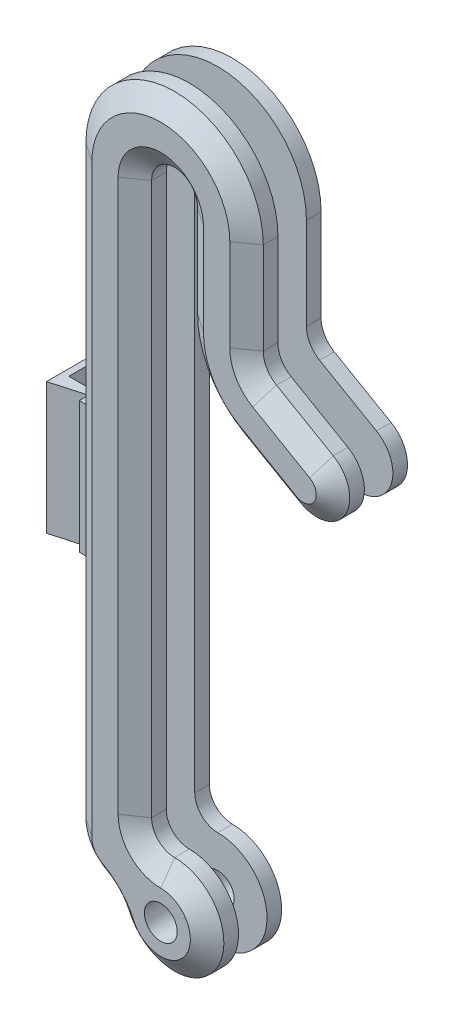
from build123d import *
from OCP.BRepFilletAPI import BRepFilletAPI_MakeChamfer

# Parameters (mm, degrees)
SKETCH1_R           = 3.175
BOSS_EXTRUDE1_DEPTH = 16.51
FILLET1_R           = 10.16
CHAMFER1_SIZE       = 3.81
CHAMFER1_SIZE2      = 2.667790721
SPLIT1_START        = 5.503333164
SPLIT1_OUTLINE_R    = 3.175
SPLIT1_DEPTH        = 5.503333418
SKETCH4_W           = 11.174418558
SKETCH4_H           = 25.4
BOSS_EXTRUDE2_DEPTH = 12.7
SKETCH5_W           = 5.08
SKETCH5_H           = 11.174418558
CUT_EXTRUDE1_DEPTH  = 95.217988066
SKETCH7_W           = 5.08
SKETCH7_H           = 5.08
CUT_EXTRUDE2_DEPTH  = 20.32


# Read off the part's stored shape, not the designer's step: Split1
with BuildPart() as part:
    # Sketch1 → Boss-Extrude1 (new body)
    with BuildSketch(Plane.XY):
        with BuildLine():
            Line((4.445, 120.65), (4.445, 102.87))
            ThreePointArc((4.445, 102.87), (6.827068321, 93.98), (13.335, 87.472068321))
            Line((13.335, 87.472068321), (24.333522628, 81.122068321))
            ThreePointArc((24.333522628, 81.122068321), (33.007783942, 83.446329635), (30.683522628, 92.120590949))
            Line((30.683522628, 92.120590949), (19.685, 98.470590949))
            ThreePointArc((19.685, 98.470590949), (17.825590949, 100.33), (17.145, 102.87))
            Line((17.145, 102.87), (17.145, 120.65))
            ThreePointArc((17.145, 120.65), (0, 137.795), (-17.145, 120.65))
            Line((-17.145, 120.65), (-17.145, 7.62))
            ThreePointArc((-17.145, 7.62), (-14.913153673, 2.231846327), (-9.525, 0))
            ThreePointArc((-9.525, 0), (6.735192091, -6.735192091), (0, 9.525))
            ThreePointArc((0, 9.525), (-3.143089642, 10.826910358), (-4.445, 13.97))
            Line((-4.445, 13.97), (-4.445, 120.65))
            ThreePointArc((-4.445, 120.65), (0, 125.095), (4.445, 120.65))
        make_face()
        Circle(SKETCH1_R, mode=Mode.SUBTRACT)
    extrude(amount=BOSS_EXTRUDE1_DEPTH)

    # Fillet1
    fillet1_edges = [part.edges().sort_by_distance(p)[0] for p in [
        (-9.525, 0, 8.255),
    ]]
    fillet(fillet1_edges, radius=FILLET1_R)

    # Chamfer1: one chamfer whose edges measure the first distance from different faces: ONE call of the kernel's chamfer builder (chamfer() names one face for all edges)
    chamfer1_edges_1 = [part.edges().sort_by_distance(p)[0] for p in [
        (-3.143089642, 10.826910358, 16.51),
        (-4.445, 67.31, 16.51),
        (0, 125.095, 16.51),
        (4.445, 111.76, 16.51),
        (6.827068321, 93.98, 16.51),
        (18.834261314, 84.297068321, 16.51),
        (33.007783942, 83.446329635, 16.51),
        (25.184261314, 95.295590949, 16.51),
        (17.825590949, 100.33, 16.51),
        (7.990751239, -5.183967557, 16.51),
        (-10.525505779, -1.115347445, 16.51),
        (17.145, 111.76, 16.51),
        (-16.069536152, 3.716995189, 16.51),
        (0, 137.795, 16.51),
        (-17.145, 64.135, 16.51),
    ]]
    chamfer1_side_1 = [part.faces().sort_by_distance(p)[0] for p in [
        (-14.730576104, 4.515518933, 16.51),
    ]]
    chamfer1_edges_2 = [part.edges().sort_by_distance(p)[0] for p in [
        (-17.145, 64.135, 0),
        (0, 137.795, 0),
        (17.145, 111.76, 0),
        (17.825590949, 100.33, 0),
        (25.184261314, 95.295590949, 0),
        (33.007783942, 83.446329635, 0),
        (18.834261314, 84.297068321, 0),
        (6.827068321, 93.98, 0),
        (4.445, 111.76, 0),
        (0, 125.095, 0),
        (-4.445, 67.31, 0),
        (-3.143089642, 10.826910358, 0),
        (-16.069536152, 3.716995189, 0),
        (7.990751239, -5.183967557, 0),
        (-10.525505779, -1.115347445, 0),
    ]]
    chamfer1_side_2 = [part.faces().sort_by_distance(p)[0] for p in [
        (-14.730576104, 4.515518933, 0),
    ]]
    chamfer1 = BRepFilletAPI_MakeChamfer(part.part.solid().wrapped)
    for e in chamfer1_edges_1:
        chamfer1.Add(CHAMFER1_SIZE, CHAMFER1_SIZE2, e.wrapped, chamfer1_side_1[0].wrapped)  # the first distance lies on this face
    for e in chamfer1_edges_2:
        chamfer1.Add(CHAMFER1_SIZE, CHAMFER1_SIZE2, e.wrapped, chamfer1_side_2[0].wrapped)  # the first distance lies on this face
    add(Compound.cast(chamfer1.Shape()), mode=Mode.REPLACE)

    # Split1 outline → Split1 (cut)
    with BuildSketch(Plane.XY.offset(SPLIT1_START)):
        with BuildLine():
            ThreePointArc((-17.145, 7.62), (-16.069536152, 3.716995189), (-13.146720064, 0.915707063))
            ThreePointArc((-13.146720064, 0.915707063), (-10.525505779, -1.115347445), (-8.697909749, -3.882266219))
            ThreePointArc((-8.697909749, -3.882266219), (7.990751239, -5.183967557), (0, 9.525))
            ThreePointArc((0, 9.525), (-3.143089642, 10.826910358), (-4.445, 13.97))
            Line((-4.445, 13.97), (-4.445, 120.65))
            ThreePointArc((-4.445, 120.65), (0, 125.095), (4.445, 120.65))
            Line((4.445, 120.65), (4.445, 102.87))
            ThreePointArc((4.445, 102.87), (6.827068321, 93.98), (13.335, 87.472068321))
            Line((13.335, 87.472068321), (24.333522628, 81.122068321))
            ThreePointArc((24.333522628, 81.122068321), (33.007783942, 83.446329635), (30.683522628, 92.120590949))
            Line((30.683522628, 92.120590949), (19.685, 98.470590949))
            ThreePointArc((19.685, 98.470590949), (17.825590949, 100.33), (17.145, 102.87))
            Line((17.145, 102.87), (17.145, 120.65))
            ThreePointArc((17.145, 120.65), (0, 137.795), (-17.145, 120.65))
            Line((-17.145, 120.65), (-17.145, 7.62))
        make_face()
        Circle(SPLIT1_OUTLINE_R, mode=Mode.SUBTRACT)
    extrude(amount=SPLIT1_DEPTH, mode=Mode.SUBTRACT)

    # Sketch4 → Boss-Extrude2 (add)
    with BuildSketch(Plane.ZY.offset(17.145)):
        with Locations((8.255, 64.135)):
            Rectangle(SKETCH4_W, SKETCH4_H)
    extrude(amount=BOSS_EXTRUDE2_DEPTH)

    # Sketch5 → Cut-Extrude1 (cut, through all)
    with BuildSketch(Plane(origin=(0, 76.835, 0), x_dir=(1, 0, 0), z_dir=(0, 1, 0))):
        Polygon((-24.765, -2.667790721), (-18.414778652, -4.445000002), (-18.414778652, -2.667790721), align=None)
        with Locations((-27.305, -8.255)):
            Rectangle(SKETCH5_W, SKETCH5_H)
        Polygon((-18.415, -12.064999998), (-24.762176004, -13.842209279), (-18.415, -13.842209279), align=None)
    extrude(amount=-CUT_EXTRUDE1_DEPTH, mode=Mode.SUBTRACT)

    # Sketch7 → Cut-Extrude2 (cut)
    with BuildSketch(Plane(origin=(0, 76.835, 0), x_dir=(1, 0, 0), z_dir=(0, 1, 0))):
        with Locations((-20.955000002, -8.255)):
            Rectangle(SKETCH7_W, SKETCH7_H)
    extrude(amount=-CUT_EXTRUDE2_DEPTH, mode=Mode.SUBTRACT)


solid = part.part
